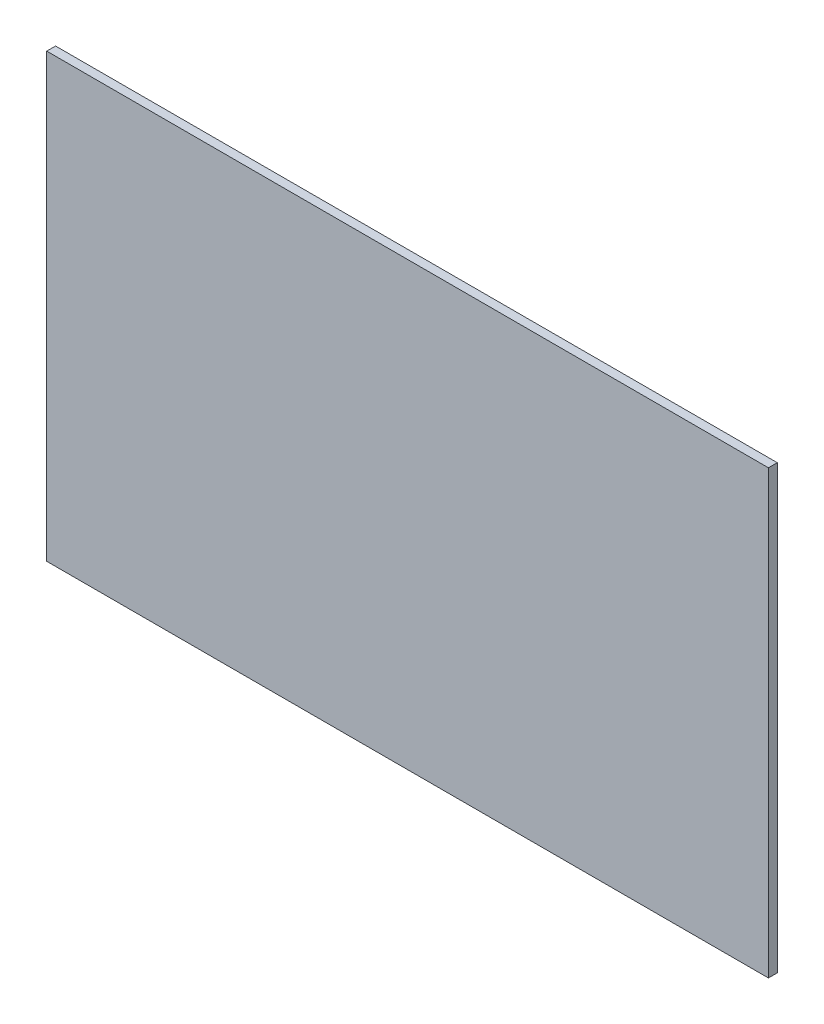
from build123d import *

# Parameters (mm, degrees)
SKETCH1_W           = 245
SKETCH1_H           = 150
BOSS_EXTRUDE1_DEPTH = 3


with BuildPart() as part:
    # Sketch1 → Boss-Extrude1 (new body)
    with BuildSketch(Plane.XY):
        Rectangle(SKETCH1_W, SKETCH1_H)
    extrude(amount=BOSS_EXTRUDE1_DEPTH)


solid = part.part
